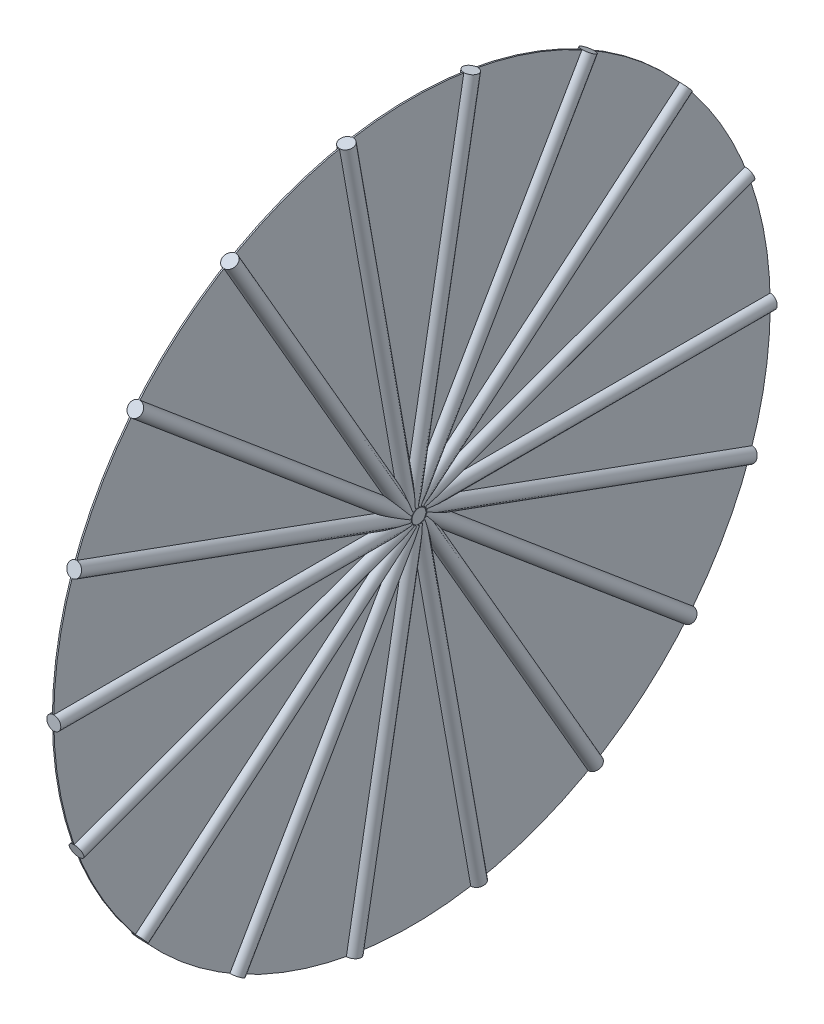
from build123d import *

# Parameters (mm, degrees)
SKETCH3_W           = 25
SKETCH3_H           = 25.4
SKETCH6_W           = 1274.6
SKETCH6_H           = 25.4
SKETCH7_R           = 1300
BOSS_EXTRUDE2_DEPTH = 5.08
CIRPATTERN1_COUNT   = 18


with BuildPart() as part:
    # Sketch3 → Revolve2 (revolve)
    with BuildSketch(Plane(origin=(39.784286719, 0, 0), x_dir=(1, 0, 0), z_dir=(0, 0, 1))):
        with Locations((12.5, 12.7)):
            Rectangle(SKETCH3_W, SKETCH3_H)
    revolve(axis=Axis((39.784286719, 0, 0), (1, 0, 0)))

    # Sketch7 → Boss-Extrude2 (add)
    with BuildSketch(Plane.ZY.offset(-39.784286719)):
        Circle(SKETCH7_R)
    extrude(amount=BOSS_EXTRUDE2_DEPTH)


with BuildPart() as body_2:
    # Sketch6 → Revolve3 (revolve)
    with BuildSketch(Plane.ZY.offset(-39.784286719)):
        with Locations((662.7, 0)):
            Rectangle(SKETCH6_W, SKETCH6_H)
    revolve3 = revolve(axis=Axis((39.784286719, -12.7, 25.4), (0, 0, 1)))

    # CirPattern1: Revolve3 ×18 about axis
    cirpattern1_axis = Axis((34.704286719, 0, 0), (-1, 0, 0))
    for i in range(1, CIRPATTERN1_COUNT):
        add(revolve3.rotate(cirpattern1_axis, i * 360 / CIRPATTERN1_COUNT))


solid = Compound([part.part, body_2.part])
